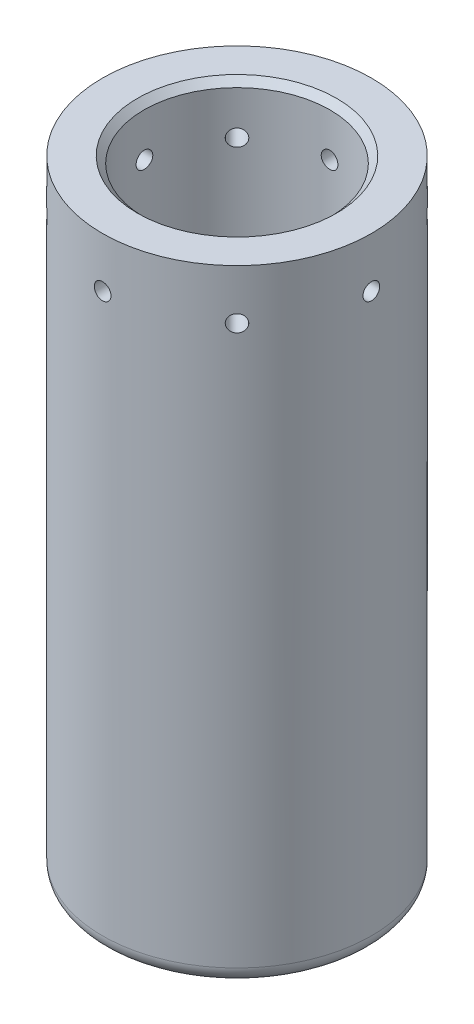
from build123d import *

# Parameters (mm, degrees)
SKETCH1_R           = 16.15
SKETCH1_R_2         = 11.15
BOSS_EXTRUDE1_DEPTH = 70
BOSS_EXTRUDE2_START = 5
SKETCH2_R           = 16.15
BOSS_EXTRUDE2_DEPTH = 5
CHAMFER1_SIZE       = 5
FILLET1_R           = 2
CHAMFER2_SIZE       = 0.8
SKETCH3_R           = 1
CUT_EXTRUDE1_DEPTH  = 10
CIRPATTERN1_COUNT   = 8


with BuildPart() as part:
    # Sketch1 → Boss-Extrude1 (new body)
    with BuildSketch(Plane(origin=(0, 0, 0), x_dir=(1, 0, 0), z_dir=(0, 1, 0))):
        Circle(SKETCH1_R)
        Circle(SKETCH1_R_2, mode=Mode.SUBTRACT)
    extrude(amount=BOSS_EXTRUDE1_DEPTH)

    # Sketch2 → Boss-Extrude2 (add)
    with BuildSketch(Plane.XZ.offset(BOSS_EXTRUDE2_START)):
        Circle(SKETCH2_R)
    extrude(amount=-BOSS_EXTRUDE2_DEPTH)

    # Chamfer1
    chamfer1_edges = [part.edges().sort_by_distance(p)[0] for p in [
        (-11.15, 0, 0),
    ]]
    chamfer(chamfer1_edges, length=CHAMFER1_SIZE)

    # Fillet1
    fillet1_edges = [part.edges().sort_by_distance(p)[0] for p in [
        (-16.15, -5, 0),
    ]]
    fillet(fillet1_edges, radius=FILLET1_R)

    # Chamfer2
    chamfer2_edges = [part.edges().sort_by_distance(p)[0] for p in [
        (-11.15, 70, 0),
    ]]
    chamfer(chamfer2_edges, length=CHAMFER2_SIZE)

    # Sketch3 → Cut-Extrude1 (cut)
    with BuildSketch(Plane(origin=(16.15, 0, 0), x_dir=(0, 0, -1), z_dir=(1, 0, 0))):
        with Locations((0, 64)):
            Circle(SKETCH3_R)
    cut_extrude1 = extrude(amount=-CUT_EXTRUDE1_DEPTH, mode=Mode.SUBTRACT)

    # CirPattern1: Cut-Extrude1 ×8 about axis
    cirpattern1_axis = Axis((0, 69.2, 0), (0, -1, 0))
    for i in range(1, CIRPATTERN1_COUNT):
        add(cut_extrude1.rotate(cirpattern1_axis, i * 360 / CIRPATTERN1_COUNT), mode=Mode.SUBTRACT)


solid = part.part
